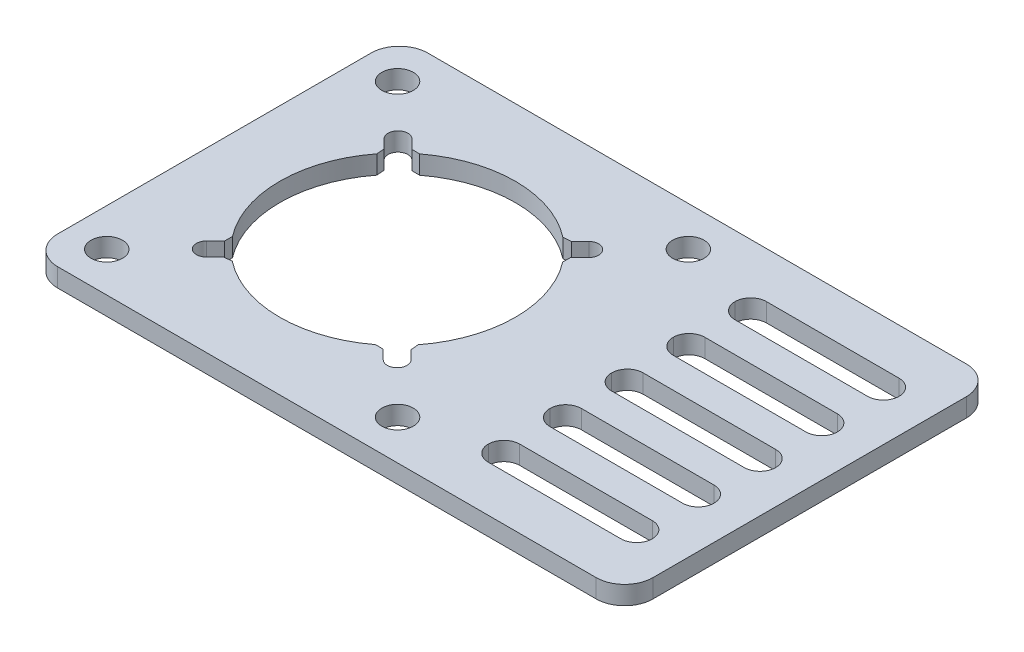
from build123d import *

# Parameters (mm, degrees)
SKETCH1_W           = 96.5
SKETCH1_H           = 60
BOSS_EXTRUDE1_DEPTH = 3
SKETCH2_R           = 2.55
SKETCH2_W           = 26.6
SKETCH2_H           = 5.1
CUT_EXTRUDE1_DEPTH  = 57.895188725
FILLET1_R           = 2.55
FILLET2_R           = 4.6


with BuildPart() as part:
    # Sketch1 → Boss-Extrude1 (new body)
    with BuildSketch(Plane(origin=(0, 0, 0), x_dir=(1, 0, 0), z_dir=(0, 1, 0))):
        Rectangle(SKETCH1_W, SKETCH1_H)
    extrude(amount=BOSS_EXTRUDE1_DEPTH)

    # Sketch2 → Cut-Extrude1 (cut, through all)
    with BuildSketch(Plane(origin=(0, 3, 0), x_dir=(1, 0, 0), z_dir=(0, 1, 0))):
        with Locations(Location((-42.12, 23.57, 0), (0, 0, 270))):
            Circle(SKETCH2_R)
        with Locations(Location((5.02, 23.57, 0), (0, 0, 270))):
            Circle(SKETCH2_R)
        with Locations(Location((5.02, -23.57, 0), (0, 0, 270))):
            Circle(SKETCH2_R)
        with Locations(Location((-42.12, -23.57, 0), (0, 0, 270))):
            Circle(SKETCH2_R)
        with Locations((29.45, 20)):
            Rectangle(SKETCH2_W, SKETCH2_H)
        with Locations((29.45, 10)):
            Rectangle(SKETCH2_W, SKETCH2_H)
        with Locations((29.45, 0)):
            Rectangle(SKETCH2_W, SKETCH2_H)
        with Locations((29.45, -10)):
            Rectangle(SKETCH2_W, SKETCH2_H)
        with Locations((29.45, -20)):
            Rectangle(SKETCH2_W, SKETCH2_H)
        with BuildLine():
            Line((-5.569839705, 15.180766292), (-4.144713605, 16.599616741))
            ThreePointArc((-4.144713605, 16.599616741), (-1.881977414, 16.594623682), (-1.886970473, 14.331887491))
            Line((-1.886970473, 14.331887491), (-3.365955143, 12.859415643))
            Line((-3.365955143, 12.859415643), (-3.36875518, 11.590504981))
            ThreePointArc((-3.36875518, 11.590504981), (0.549812749, -0.084575096), (-3.471995372, -11.72449472))
            Line((-3.471995372, -11.72449472), (-3.369233708, -12.980160295))
            Line((-3.369233708, -12.980160295), (-1.950383259, -14.405286395))
            ThreePointArc((-1.950383259, -14.405286395), (-1.955376318, -16.668022586), (-4.218112509, -16.663029527))
            Line((-4.218112509, -16.663029527), (-5.690584357, -15.184044857))
            Line((-5.690584357, -15.184044857), (-6.959495019, -15.18124482))
            ThreePointArc((-6.959495019, -15.18124482), (-18.634575096, -19.099812749), (-30.27449472, -15.078004628))
            Line((-30.27449472, -15.078004628), (-31.530160295, -15.180766292))
            Line((-31.530160295, -15.180766292), (-32.955286395, -16.599616741))
            ThreePointArc((-32.955286395, -16.599616741), (-35.218022586, -16.594623682), (-35.213029527, -14.331887491))
            Line((-35.213029527, -14.331887491), (-33.734044857, -12.859415643))
            Line((-33.734044857, -12.859415643), (-33.73124482, -11.590504981))
            ThreePointArc((-33.73124482, -11.590504981), (-37.649812749, 0.084575096), (-33.628004628, 11.72449472))
            Line((-33.628004628, 11.72449472), (-33.730766292, 12.980160295))
            Line((-33.730766292, 12.980160295), (-35.149616741, 14.405286395))
            ThreePointArc((-35.149616741, 14.405286395), (-35.144623682, 16.668022586), (-32.881887491, 16.663029527))
            Line((-32.881887491, 16.663029527), (-31.409415643, 15.184044857))
            Line((-31.409415643, 15.184044857), (-30.140504981, 15.18124482))
            ThreePointArc((-30.140504981, 15.18124482), (-18.465424904, 19.099812749), (-6.82550528, 15.078004628))
            Line((-6.82550528, 15.078004628), (-5.569839705, 15.180766292))
        make_face()
    extrude(amount=-CUT_EXTRUDE1_DEPTH, mode=Mode.SUBTRACT)

    # Fillet1
    fillet1_edges = [part.edges().sort_by_distance(p)[0] for p in [
        (42.75, 1.5, 12.55),
        (42.75, 1.5, 22.55),
        (42.75, 1.5, 17.45),
        (42.75, 1.5, 7.45),
        (42.75, 1.5, 2.55),
        (42.75, 1.5, -2.55),
        (42.75, 1.5, -7.45),
        (42.75, 1.5, -12.55),
        (42.75, 1.5, -17.45),
        (42.75, 1.5, -22.55),
        (16.15, 1.5, -17.45),
        (16.15, 1.5, -22.55),
        (16.15, 1.5, 22.55),
        (16.15, 1.5, 17.45),
        (16.15, 1.5, 12.55),
        (16.15, 1.5, 7.45),
        (16.15, 1.5, 2.55),
        (16.15, 1.5, -2.55),
        (16.15, 1.5, -7.45),
        (16.15, 1.5, -12.55),
    ]]
    fillet(fillet1_edges, radius=FILLET1_R - 0.0001)  # a hair under: the kernel refuses the full size

    # Fillet2
    fillet2_edges = [part.edges().sort_by_distance(p)[0] for p in [
        (-48.25, 1.5, -30),
        (48.25, 1.5, -30),
        (48.25, 1.5, 30),
        (-48.25, 1.5, 30),
    ]]
    fillet(fillet2_edges, radius=FILLET2_R)


solid = part.part
